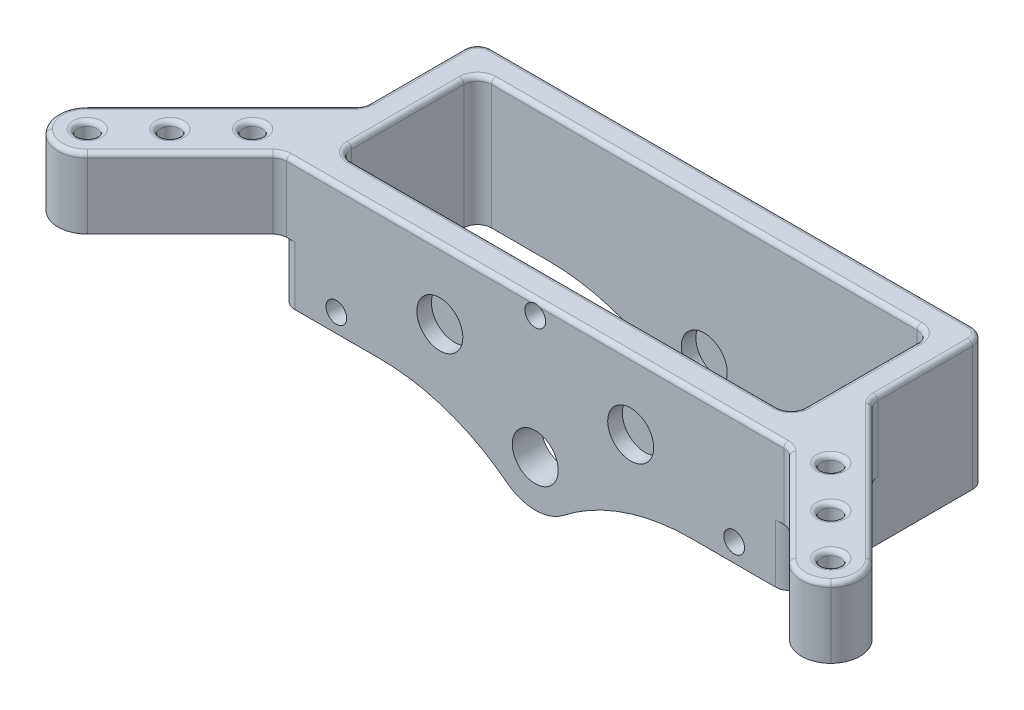
from build123d import *

# Parameters (mm, degrees)
SKETCH2_R           = 2.1
SKETCH2_W           = 98.55
SKETCH2_H           = 30.4
BOSS_EXTRUDE1_DEPTH = 28
CUT_EXTRUDE1_START  = -42.75
SKETCH3_R           = 2.25
CUT_EXTRUDE1_DEPTH  = 6.35
BOSS_EXTRUDE2_DEPTH = 6
BOSS_EXTRUDE3_START = -42.75
BOSS_EXTRUDE3_DEPTH = 6.35
CUT_EXTRUDE3_START  = -6
CUT_EXTRUDE3_DEPTH  = 3.175
CUT_EXTRUDE4_START  = -42.75
CUT_EXTRUDE4_DEPTH  = 6.35
FILLET2_R           = 6.35
CUT_EXTRUDE5_START  = -42.75
SKETCH4_7_R         = 5
CUT_EXTRUDE5_DEPTH  = 3.175
SKETCH2_4_R         = 2.1
CUT_EXTRUDE6_DEPTH  = 12.7
FILLET1_R           = 3
FILLET3_R           = 3
FILLET4_R           = 1


# Read off the part's stored shape, not the designer's step: Boss-Extrude3
# Some blends are built 0.0001 mm under size
with BuildPart() as part:
    # Sketch2 → Boss-Extrude1 (new body)
    with BuildSketch(Plane(origin=(0, 0, 0), x_dir=(1, 0, 0), z_dir=(0, 1, 0))):
        Polygon((-80.82230509, -47.59730509), (-55.275, -22.05), (55.275, -22.05), (80.82230509, -47.59730509), (89.802561211, -38.617048969), (55.275, -4.089487758), (55.275, 20.7), (-55.275, 20.7), (-55.275, -4.089487758), (-89.802561211, -38.617048969), align=None)
        with Locations(Location((-80.82230509, -38.617048969, 0), (0, 0, 270))):
            Circle(SKETCH2_R, mode=Mode.SUBTRACT)
        with Locations(Location((-71.842048969, -29.636792847, 0), (0, 0, 270))):
            Circle(SKETCH2_R, mode=Mode.SUBTRACT)
        with Locations(Location((-62.861792847, -20.656536726, 0), (0, 0, 270))):
            Circle(SKETCH2_R, mode=Mode.SUBTRACT)
        with Locations((0, -0.5)):
            Rectangle(SKETCH2_W, SKETCH2_H, mode=Mode.SUBTRACT)
        with Locations(Location((62.861792847, -20.656536726, 0), (0, 0, 270))):
            Circle(SKETCH2_R, mode=Mode.SUBTRACT)
        with Locations(Location((80.82230509, -38.617048969, 0), (0, 0, 270))):
            Circle(SKETCH2_R, mode=Mode.SUBTRACT)
        with Locations(Location((71.842048969, -29.636792847, 0), (0, 0, 270))):
            Circle(SKETCH2_R, mode=Mode.SUBTRACT)
    extrude(amount=BOSS_EXTRUDE1_DEPTH)

    # Sketch3 → Cut-Extrude1 (cut)
    with BuildSketch(Plane(origin=(0, 0, -20.7), x_dir=(-1, 0, 0), z_dir=(0, 0, -1)).offset(CUT_EXTRUDE1_START)):
        with Locations((-43.25, 4)):
            Circle(SKETCH3_R)
        with Locations((0, 25)):
            Circle(SKETCH3_R)
        with Locations((43.25, 4)):
            Circle(SKETCH3_R)
    extrude(amount=CUT_EXTRUDE1_DEPTH, mode=Mode.SUBTRACT)

    # Sketch4 → Boss-Extrude2 (add)
    with BuildSketch(Plane(origin=(0, 0, -20.7), x_dir=(-1, 0, 0), z_dir=(0, 0, -1))):
        with BuildLine():
            ThreePointArc((6.154225261, -9.531120561), (19.204123806, -2.449444335), (33.84824251, 0))
            Line((33.84824251, 0), (-33.848242566, 0))
            ThreePointArc((-33.848242566, 0), (-19.204124104, -2.449444233), (-6.154225714, -9.531120208))
            ThreePointArc((-6.154225714, -9.531120208), (-2.87e-07, -11.649146733), (6.154225261, -9.531120561))
        make_face()
    extrude(amount=-BOSS_EXTRUDE2_DEPTH)

    # Boss-Extrude3 outline → Boss-Extrude3 (add)
    with BuildSketch(Plane(origin=(0, 0, -20.7), x_dir=(-1, 0, 0), z_dir=(0, 0, -1)).offset(BOSS_EXTRUDE3_START)):
        with BuildLine():
            ThreePointArc((-33.84824251, 0), (-19.204124195, -2.449444201), (-6.154225911, -9.531120054))
            ThreePointArc((-6.154225911, -9.531120054), (0, -11.649146733), (6.154225911, -9.531120054))
            ThreePointArc((6.154225911, -9.531120054), (19.204124195, -2.449444201), (33.84824251, 0))
            Line((33.84824251, 0), (-33.84824251, 0))
        make_face()
    extrude(amount=BOSS_EXTRUDE3_DEPTH)

    # Sketch4<5> → Cut-Extrude3 (cut)
    with BuildSketch(Plane(origin=(0, 0, -20.7), x_dir=(-1, 0, 0), z_dir=(0, 0, -1)).offset(CUT_EXTRUDE3_START)):
        with BuildLine():
            ThreePointArc((5, -1.649146733), (4.929554458, -0.812789844), (4.720202861, 0))
            Line((4.720202861, 0), (-4.720202861, 0))
            ThreePointArc((-4.720202861, 0), (-0.836356889, -6.578701191), (5, -1.649146733))
        make_face()
        with BuildLine():
            Line((-4.720202861, 0), (4.720202861, 0))
            ThreePointArc((4.720202861, 0), (0, 3.350853267), (-4.720202861, 0))
        make_face()
    extrude(amount=CUT_EXTRUDE3_DEPTH, mode=Mode.SUBTRACT)

    # Sketch4<6> → Cut-Extrude4 (cut)
    with BuildSketch(Plane(origin=(0, 0, -20.7), x_dir=(-1, 0, 0), z_dir=(0, 0, -1)).offset(CUT_EXTRUDE4_START)):
        with BuildLine():
            ThreePointArc((5, -1.649146733), (4.929554458, -0.812789844), (4.720202861, 0))
            Line((4.720202861, 0), (-4.720202861, 0))
            ThreePointArc((-4.720202861, 0), (-0.836356889, -6.578701191), (5, -1.649146733))
        make_face()
        with BuildLine():
            Line((-4.720202861, 0), (4.720202861, 0))
            ThreePointArc((4.720202861, 0), (0, 3.350853267), (-4.720202861, 0))
        make_face()
    extrude(amount=CUT_EXTRUDE4_DEPTH, mode=Mode.SUBTRACT)

    # Fillet2
    fillet2_edges = [part.edges().sort_by_distance(p)[0] for p in [
        (89.802561211, 14, 38.617048969),
        (80.82230509, 14, 47.59730509),
        (-89.802561211, 14, 38.617048969),
        (-80.82230509, 14, 47.59730509),
    ]]
    fillet(fillet2_edges, radius=FILLET2_R - 0.0001)  # a hair under: the kernel refuses the full size

    # Sketch4<7> → Cut-Extrude5 (cut)
    with BuildSketch(Plane(origin=(0, 0, -20.7), x_dir=(-1, 0, 0), z_dir=(0, 0, -1)).offset(CUT_EXTRUDE5_START)):
        with Locations((-20.75, 13)):
            Circle(SKETCH4_7_R)
        with Locations((20.75, 13)):
            Circle(SKETCH4_7_R)
    extrude(amount=CUT_EXTRUDE5_DEPTH, mode=Mode.SUBTRACT)

    # Sketch2<4> → Cut-Extrude6 (cut)
    # profile 1 of 2: a face of its own
    with BuildSketch(Plane(origin=(0, 0, 0), x_dir=(1, 0, 0), z_dir=(0, 1, 0))):
        Polygon((-80.82230509, -47.59730509), (-55.275, -22.05), (-55.275, -4.089487758), (-89.802561211, -38.617048969), align=None)
        with Locations(Location((-80.82230509, -38.617048969, 0), (0, 0, 270))):
            Circle(SKETCH2_4_R, mode=Mode.SUBTRACT)
        with Locations(Location((-71.842048969, -29.636792847, 0), (0, 0, 270))):
            Circle(SKETCH2_4_R, mode=Mode.SUBTRACT)
        with Locations(Location((-62.861792847, -20.656536726, 0), (0, 0, 270))):
            Circle(SKETCH2_4_R, mode=Mode.SUBTRACT)
    # profile 2 of 2: a face of its own
    with BuildSketch(Plane(origin=(0, 0, 0), x_dir=(1, 0, 0), z_dir=(0, 1, 0))):
        Polygon((55.275, -4.089487758), (55.275, -22.05), (80.82230509, -47.59730509), (89.802561211, -38.617048969), align=None)
        with Locations(Location((80.82230509, -38.617048969, 0), (0, 0, 270))):
            Circle(SKETCH2_4_R, mode=Mode.SUBTRACT)
        with Locations(Location((71.842048969, -29.636792847, 0), (0, 0, 270))):
            Circle(SKETCH2_4_R, mode=Mode.SUBTRACT)
        with Locations(Location((62.861792847, -20.656536726, 0), (0, 0, 270))):
            Circle(SKETCH2_4_R, mode=Mode.SUBTRACT)
    extrude(amount=CUT_EXTRUDE6_DEPTH, mode=Mode.SUBTRACT)

    # Fillet1
    fillet1_edges = [part.edges().sort_by_distance(p)[0] for p in [
        (-55.275, 6.35, 22.05),
        (55.275, 6.35, 22.05),
        (-49.275, 14, -14.7),
        (-49.275, 14, 15.7),
        (49.275, 14, 15.7),
        (49.275, 14, -14.7),
        (-55.275, 14, -20.7),
        (55.275, 14, -20.7),
    ]]
    fillet(fillet1_edges, radius=FILLET1_R)

    # Fillet3
    fillet3_edges = [part.edges().sort_by_distance(p)[0] for p in [
        (55.275, 20.35, 4.089487758),
        (55.275, 20.35, 22.05),
        (-55.275, 20.35, 22.05),
        (-55.275, 20.35, 4.089487758),
    ]]
    fillet(fillet3_edges, radius=FILLET3_R)

    # Fillet4
    # the kernel refuses this fillet: 1 mm, written as the material it takes off along each edge
    with BuildSketch(Plane(origin=(62.861792847, 28, 20.656536726), x_dir=(0, 0, 1), z_dir=(-1, 0, 0))) as fillet4_piece_1:
        with BuildLine():
            CenterArc((2.1 + FILLET4_R, -FILLET4_R), FILLET4_R, 90, 90)
            Line((2.1 + FILLET4_R, 0), (2.1, 0))
            Line((2.1, 0), (2.1, -FILLET4_R))
        make_face()
    revolve(axis=Axis((62.861792847, 28, 20.656536726), (0, 1, 0)), mode=Mode.SUBTRACT)
    with BuildSketch(Plane(origin=(71.842048969, 28, 29.636792847), x_dir=(0, 0, 1), z_dir=(-1, 0, 0))) as fillet4_piece_2:
        with BuildLine():
            CenterArc((2.1 + FILLET4_R, -FILLET4_R), FILLET4_R, 90, 90)
            Line((2.1 + FILLET4_R, 0), (2.1, 0))
            Line((2.1, 0), (2.1, -FILLET4_R))
        make_face()
    revolve(axis=Axis((71.842048969, 28, 29.636792847), (0, 1, 0)), mode=Mode.SUBTRACT)
    with BuildSketch(Plane(origin=(85.312503861, 28, 34.126991619), x_dir=(0, -1, 0), z_dir=(-0.7071067811865543, 0, -0.7071067811865408)), Plane(origin=(-56.153679656, 28, 4.968167414), x_dir=(0, -1, 0), z_dir=(-0.707106781186541, 0, 0.707106781186554))) as fillet4_piece_3:
        with BuildLine():
            CenterArc((FILLET4_R, FILLET4_R), FILLET4_R, 180, 90)
            Line((0, FILLET4_R), (0, 0))
            Line((0, 0), (FILLET4_R, 0))
        make_face()
    extrude(amount=41.236804653, mode=Mode.SUBTRACT)
    with BuildSketch(Plane(origin=(-80.82230509, 28, 38.61719039), x_dir=(0.7071067811865542, 0, 0.7071067811865408), z_dir=(0.7071067811865408, 0, -0.7071067811865542))) as fillet4_piece_4:
        with BuildLine():
            CenterArc((6.3499 - FILLET4_R, FILLET4_R), FILLET4_R, 270, 90)
            Line((6.3499 - FILLET4_R, 0), (6.3499, 0))
            Line((6.3499, 0), (6.3499, FILLET4_R))
        make_face()
    revolve(axis=Axis((-80.82230509, 28, 38.61719039), (0, -1, 0)), revolution_arc=90, mode=Mode.SUBTRACT)
    with BuildSketch(Plane(origin=(-80.822446511, 28, 38.617048969), x_dir=(-0.7071067811864334, 0, 0.7071067811866617), z_dir=(0.7071067811866617, 0, 0.7071067811864334))) as fillet4_piece_5:
        with BuildLine():
            CenterArc((6.3499 - FILLET4_R, FILLET4_R), FILLET4_R, 270, 90)
            Line((6.3499 - FILLET4_R, 0), (6.3499, 0))
            Line((6.3499, 0), (6.3499, FILLET4_R))
        make_face()
    revolve(axis=Axis((-80.822446511, 28, 38.617048969), (0, -1, 0)), revolution_arc=90, mode=Mode.SUBTRACT)
    with BuildSketch(Plane(origin=(80.82230509, 28, 38.61719039), x_dir=(-0.7071067811865408, 0, 0.7071067811865542), z_dir=(-0.7071067811865542, 0, -0.7071067811865408))) as fillet4_piece_6:
        with BuildLine():
            CenterArc((6.3499 - FILLET4_R, -FILLET4_R), FILLET4_R, 0, 90)
            Line((6.3499 - FILLET4_R, 0), (6.3499, 0))
            Line((6.3499, 0), (6.3499, -FILLET4_R))
        make_face()
    revolve(axis=Axis((80.82230509, 28, 38.61719039), (0, 1, 0)), revolution_arc=90, mode=Mode.SUBTRACT)
    with BuildSketch(Plane(origin=(80.822446511, 28, 38.617048969), x_dir=(0.7071067811865537, 0, 0.7071067811865414), z_dir=(-0.7071067811865414, 0, 0.7071067811865537))) as fillet4_piece_7:
        with BuildLine():
            CenterArc((6.3499 - FILLET4_R, -FILLET4_R), FILLET4_R, 0, 90)
            Line((6.3499 - FILLET4_R, 0), (6.3499, 0))
            Line((6.3499, 0), (6.3499, -FILLET4_R))
        make_face()
    revolve(axis=Axis((80.822446511, 28, 38.617048969), (0, 1, 0)), revolution_arc=90, mode=Mode.SUBTRACT)
    with BuildSketch(Plane(origin=(-55.275, 28, -17.7), x_dir=(0, -1, 0), z_dir=(0, 0, 1)), Plane(origin=(55.275, 28, 2.846847071), x_dir=(0, -1, 0), z_dir=(0, 0, -1))) as fillet4_piece_8:
        with BuildLine():
            CenterArc((FILLET4_R, FILLET4_R), FILLET4_R, 180, 90)
            Line((0, FILLET4_R), (0, 0))
            Line((0, 0), (FILLET4_R, 0))
        make_face()
    extrude(amount=20.546847071, mode=Mode.SUBTRACT)
    with BuildSketch(Plane(origin=(46.275, 28, 15.7), x_dir=(0, -1, 0), z_dir=(-1, 0, 0)), Plane(origin=(-46.275, 28, -14.7), x_dir=(0, -1, 0), z_dir=(1, 0, 0))) as fillet4_piece_9:
        with BuildLine():
            CenterArc((FILLET4_R, FILLET4_R), FILLET4_R, 180, 90)
            Line((0, FILLET4_R), (0, 0))
            Line((0, 0), (FILLET4_R, 0))
        make_face()
    extrude(amount=92.55, mode=Mode.SUBTRACT)
    with BuildSketch(Plane(origin=(49.275, 28, -11.7), x_dir=(0, -1, 0), z_dir=(0, 0, 1)), Plane(origin=(-49.275, 28, 12.7), x_dir=(0, -1, 0), z_dir=(0, 0, -1))) as fillet4_piece_10:
        with BuildLine():
            CenterArc((FILLET4_R, FILLET4_R), FILLET4_R, 180, 90)
            Line((0, FILLET4_R), (0, 0))
            Line((0, 0), (FILLET4_R, 0))
        make_face()
    extrude(amount=24.4, mode=Mode.SUBTRACT)
    with BuildSketch(Plane(origin=(52.275, 28, -20.7), x_dir=(0, -1, 0), z_dir=(-1, 0, 0))) as fillet4_piece_11:
        with BuildLine():
            CenterArc((FILLET4_R, FILLET4_R), FILLET4_R, 180, 90)
            Line((0, FILLET4_R), (0, 0))
            Line((0, 0), (FILLET4_R, 0))
        make_face()
    extrude(amount=104.55, mode=Mode.SUBTRACT)
    with BuildSketch(Plane(origin=(-52.275, 28, -17.7), x_dir=(0, 0, -1), z_dir=(1, 0, 0))) as fillet4_piece_12:
        with BuildLine():
            CenterArc((3 - FILLET4_R, -FILLET4_R), FILLET4_R, 0, 90)
            Line((3 - FILLET4_R, 0), (3, 0))
            Line((3, 0), (3, -FILLET4_R))
        make_face()
    revolve(axis=Axis((-52.275, 28, -17.7), (0, 1, 0)), revolution_arc=90, mode=Mode.SUBTRACT)
    with BuildSketch(Plane(origin=(52.275, 28, -17.7), x_dir=(0, 0, -1), z_dir=(-1, 0, 0))) as fillet4_piece_13:
        with BuildLine():
            CenterArc((3 - FILLET4_R, FILLET4_R), FILLET4_R, 270, 90)
            Line((3 - FILLET4_R, 0), (3, 0))
            Line((3, 0), (3, FILLET4_R))
        make_face()
    revolve(axis=Axis((52.275, 28, -17.7), (0, -1, 0)), revolution_arc=90, mode=Mode.SUBTRACT)
    with BuildSketch(Plane(origin=(46.275, 28, 12.7), x_dir=(0, 0, 1), z_dir=(-1, 0, 0))) as fillet4_piece_14:
        with BuildLine():
            CenterArc((3 + FILLET4_R, -FILLET4_R), FILLET4_R, 90, 90)
            Line((3 + FILLET4_R, 0), (3, 0))
            Line((3, 0), (3, -FILLET4_R))
        make_face()
    revolve(axis=Axis((46.275, 28, 12.7), (0, 1, 0)), revolution_arc=90, mode=Mode.SUBTRACT)
    with BuildSketch(Plane(origin=(-46.275, 28, 12.7), x_dir=(0, 0, 1), z_dir=(1, 0, 0))) as fillet4_piece_15:
        with BuildLine():
            CenterArc((3 + FILLET4_R, FILLET4_R), FILLET4_R, 180, 90)
            Line((3 + FILLET4_R, 0), (3, 0))
            Line((3, 0), (3, FILLET4_R))
        make_face()
    revolve(axis=Axis((-46.275, 28, 12.7), (0, -1, 0)), revolution_arc=90, mode=Mode.SUBTRACT)
    with BuildSketch(Plane(origin=(46.275, 28, -11.7), x_dir=(0, 0, -1), z_dir=(-1, 0, 0))) as fillet4_piece_16:
        with BuildLine():
            CenterArc((3 + FILLET4_R, FILLET4_R), FILLET4_R, 180, 90)
            Line((3 + FILLET4_R, 0), (3, 0))
            Line((3, 0), (3, FILLET4_R))
        make_face()
    revolve(axis=Axis((46.275, 28, -11.7), (0, -1, 0)), revolution_arc=90, mode=Mode.SUBTRACT)
    with BuildSketch(Plane(origin=(-46.275, 28, -11.7), x_dir=(-1, 0, 0), z_dir=(0, 0, 1))) as fillet4_piece_17:
        with BuildLine():
            CenterArc((3 + FILLET4_R, FILLET4_R), FILLET4_R, 180, 90)
            Line((3 + FILLET4_R, 0), (3, 0))
            Line((3, 0), (3, FILLET4_R))
        make_face()
    revolve(axis=Axis((-46.275, 28, -11.7), (0, -1, 0)), revolution_arc=90, mode=Mode.SUBTRACT)
    with BuildSketch(Plane(origin=(-54.032359313, 28, 22.05), x_dir=(0, -1, 0), z_dir=(1, 0, 0))) as fillet4_piece_18:
        with BuildLine():
            CenterArc((FILLET4_R, FILLET4_R), FILLET4_R, 180, 90)
            Line((0, FILLET4_R), (0, 0))
            Line((0, 0), (FILLET4_R, 0))
        make_face()
    extrude(amount=108.064718626, mode=Mode.SUBTRACT)
    with BuildSketch(Plane(origin=(-76.33224774, 28, 43.10724774), x_dir=(0, -1, 0), z_dir=(0.7071067811865411, 0, -0.7071067811865539)), Plane(origin=(56.153679656, 28, 22.928679656), x_dir=(0, -1, 0), z_dir=(0.7071067811865539, 0, 0.7071067811865411))) as fillet4_piece_19:
        with BuildLine():
            CenterArc((FILLET4_R, FILLET4_R), FILLET4_R, 180, 90)
            Line((0, FILLET4_R), (0, 0))
            Line((0, 0), (FILLET4_R, 0))
        make_face()
    extrude(amount=28.536804653, mode=Mode.SUBTRACT)
    with BuildSketch(Plane(origin=(-58.275, 28, 2.846847071), x_dir=(1, 0, 0), z_dir=(0, 0, -1))) as fillet4_piece_20:
        with BuildLine():
            CenterArc((3 + FILLET4_R, FILLET4_R), FILLET4_R, 180, 90)
            Line((3 + FILLET4_R, 0), (3, 0))
            Line((3, 0), (3, FILLET4_R))
        make_face()
    revolve(axis=Axis((-58.275, 28, 2.846847071), (0, -1, 0)), revolution_arc=45, mode=Mode.SUBTRACT)
    with BuildSketch(Plane(origin=(-54.032359313, 28, 25.05), x_dir=(0, 0, -1), z_dir=(1, 0, 0))) as fillet4_piece_21:
        with BuildLine():
            CenterArc((3 + FILLET4_R, -FILLET4_R), FILLET4_R, 90, 90)
            Line((3, -FILLET4_R), (3, 0))
            Line((3, 0), (3 + FILLET4_R, 0))
        make_face()
    revolve(axis=Axis((-54.032359313, 28, 25.05), (0, 1, 0)), revolution_arc=45, mode=Mode.SUBTRACT)
    with BuildSketch(Plane(origin=(54.032359313, 28, 25.05), x_dir=(0, 0, -1), z_dir=(-1, 0, 0))) as fillet4_piece_22:
        with BuildLine():
            CenterArc((3 + FILLET4_R, FILLET4_R), FILLET4_R, 180, 90)
            Line((3 + FILLET4_R, 0), (3, 0))
            Line((3, 0), (3, FILLET4_R))
        make_face()
    revolve(axis=Axis((54.032359313, 28, 25.05), (0, -1, 0)), revolution_arc=45, mode=Mode.SUBTRACT)
    with BuildSketch(Plane(origin=(58.275, 28, 2.846847071), x_dir=(-1, 0, 0), z_dir=(0, 0, -1))) as fillet4_piece_23:
        with BuildLine():
            CenterArc((3 + FILLET4_R, -FILLET4_R), FILLET4_R, 90, 90)
            Line((3 + FILLET4_R, 0), (3, 0))
            Line((3, 0), (3, -FILLET4_R))
        make_face()
    revolve(axis=Axis((58.275, 28, 2.846847071), (0, 1, 0)), revolution_arc=45, mode=Mode.SUBTRACT)
    with BuildSketch(Plane(origin=(-80.82230509, 28, 38.617048969), x_dir=(0, 0, 1), z_dir=(-1, 0, 0))) as fillet4_piece_24:
        with BuildLine():
            CenterArc((2.1 + FILLET4_R, -FILLET4_R), FILLET4_R, 90, 90)
            Line((2.1, -FILLET4_R), (2.1, 0))
            Line((2.1, 0), (2.1 + FILLET4_R, 0))
        make_face()
    revolve(axis=Axis((-80.82230509, 28, 38.617048969), (0, 1, 0)), mode=Mode.SUBTRACT)
    with BuildSketch(Plane(origin=(-62.861792847, 28, 20.656536726), x_dir=(0, 0, 1), z_dir=(-1, 0, 0))) as fillet4_piece_25:
        with BuildLine():
            CenterArc((2.1 + FILLET4_R, -FILLET4_R), FILLET4_R, 90, 90)
            Line((2.1, -FILLET4_R), (2.1, 0))
            Line((2.1, 0), (2.1 + FILLET4_R, 0))
        make_face()
    revolve(axis=Axis((-62.861792847, 28, 20.656536726), (0, 1, 0)), mode=Mode.SUBTRACT)
    with BuildSketch(Plane(origin=(-71.842048969, 28, 29.636792847), x_dir=(0, 0, 1), z_dir=(-1, 0, 0))) as fillet4_piece_26:
        with BuildLine():
            CenterArc((2.1 + FILLET4_R, -FILLET4_R), FILLET4_R, 90, 90)
            Line((2.1, -FILLET4_R), (2.1, 0))
            Line((2.1, 0), (2.1 + FILLET4_R, 0))
        make_face()
    revolve(axis=Axis((-71.842048969, 28, 29.636792847), (0, 1, 0)), mode=Mode.SUBTRACT)
    with BuildSketch(Plane(origin=(80.82230509, 28, 38.617048969), x_dir=(0, 0, 1), z_dir=(-1, 0, 0))) as fillet4_piece_27:
        with BuildLine():
            CenterArc((2.1 + FILLET4_R, -FILLET4_R), FILLET4_R, 90, 90)
            Line((2.1 + FILLET4_R, 0), (2.1, 0))
            Line((2.1, 0), (2.1, -FILLET4_R))
        make_face()
    revolve(axis=Axis((80.82230509, 28, 38.617048969), (0, 1, 0)), mode=Mode.SUBTRACT)
    with BuildSketch(Plane(origin=(85.312362439, 28, 43.10724774), x_dir=(0, -1, 0), z_dir=(0.7071067811865406, 0, -0.7071067811865546)), Plane(origin=(-85.312503861, 28, 43.107106318), x_dir=(0, -1, 0), z_dir=(0.7071067811866623, 0, 0.7071067811864329))) as fillet4_piece_28:
        with BuildLine():
            CenterArc((FILLET4_R, FILLET4_R), FILLET4_R, 180, 90)
            Line((0, FILLET4_R), (0, 0))
            Line((0, 0), (FILLET4_R, 0))
        make_face()
    extrude(amount=0.0002, mode=Mode.SUBTRACT)


solid = part.part
